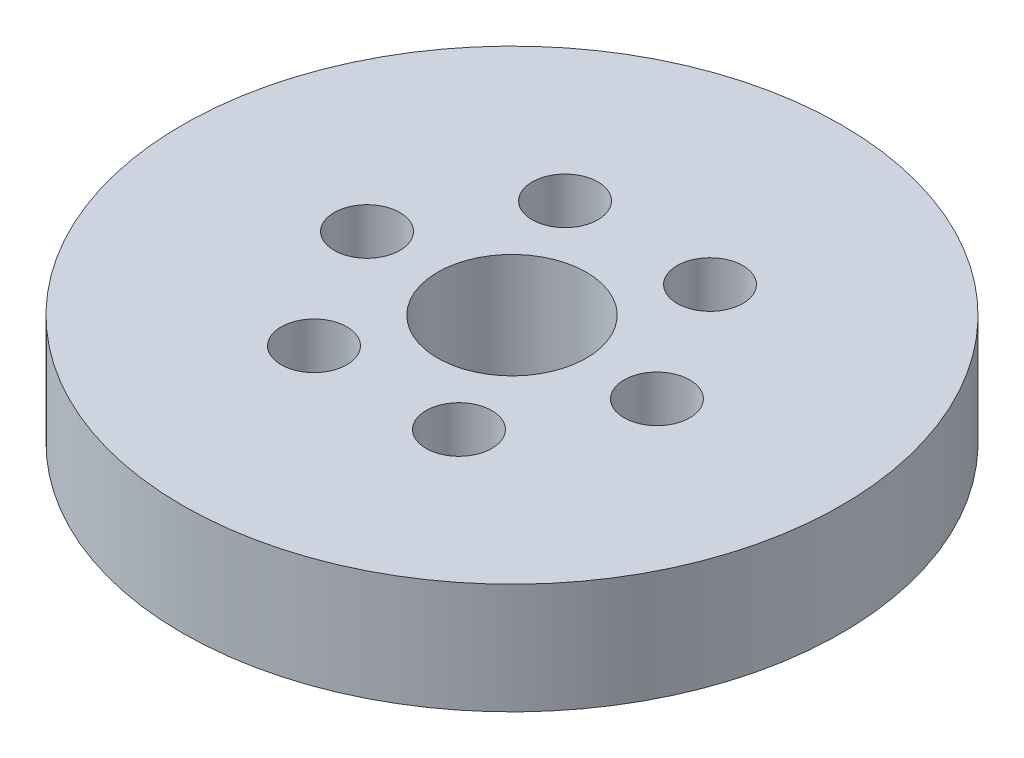
from build123d import *

# Parameters (mm, degrees)
SKETCH1_R           = 77.5
BOSS_EXTRUDE1_DEPTH = 26
SKETCH2_R           = 17.5
CUT_EXTRUDE1_DEPTH  = 113.643242141
SKETCH3_R           = 7.729527312
CUT_EXTRUDE2_DEPTH  = 21.907986857
CIRPATTERN1_COUNT   = 6


with BuildPart() as part:
    # Sketch1 → Boss-Extrude1 (new body)
    with BuildSketch(Plane(origin=(0, 0, 0), x_dir=(1, 0, 0), z_dir=(0, 1, 0))):
        Circle(SKETCH1_R)
    extrude(amount=BOSS_EXTRUDE1_DEPTH)

    # Sketch2 → Cut-Extrude1 (cut, through all)
    with BuildSketch(Plane(origin=(0, 0, 0), x_dir=(1, 0, 0), z_dir=(0, 1, 0))):
        Circle(SKETCH2_R)
    extrude(amount=CUT_EXTRUDE1_DEPTH, mode=Mode.SUBTRACT)

    # Sketch3 → Cut-Extrude2 (cut)
    with BuildSketch(Plane(origin=(0, 26, 0), x_dir=(1, 0, 0), z_dir=(0, 1, 0))):
        with Locations((-34.086543474, 0)):
            Circle(SKETCH3_R)
    cut_extrude2 = extrude(amount=-CUT_EXTRUDE2_DEPTH, mode=Mode.SUBTRACT)

    # CirPattern1: Cut-Extrude2 ×6 about axis
    cirpattern1_axis = Axis((0, 0, 0), (0, 1, 0))
    for i in range(1, CIRPATTERN1_COUNT):
        add(cut_extrude2.rotate(cirpattern1_axis, i * 360 / CIRPATTERN1_COUNT), mode=Mode.SUBTRACT)


solid = part.part
